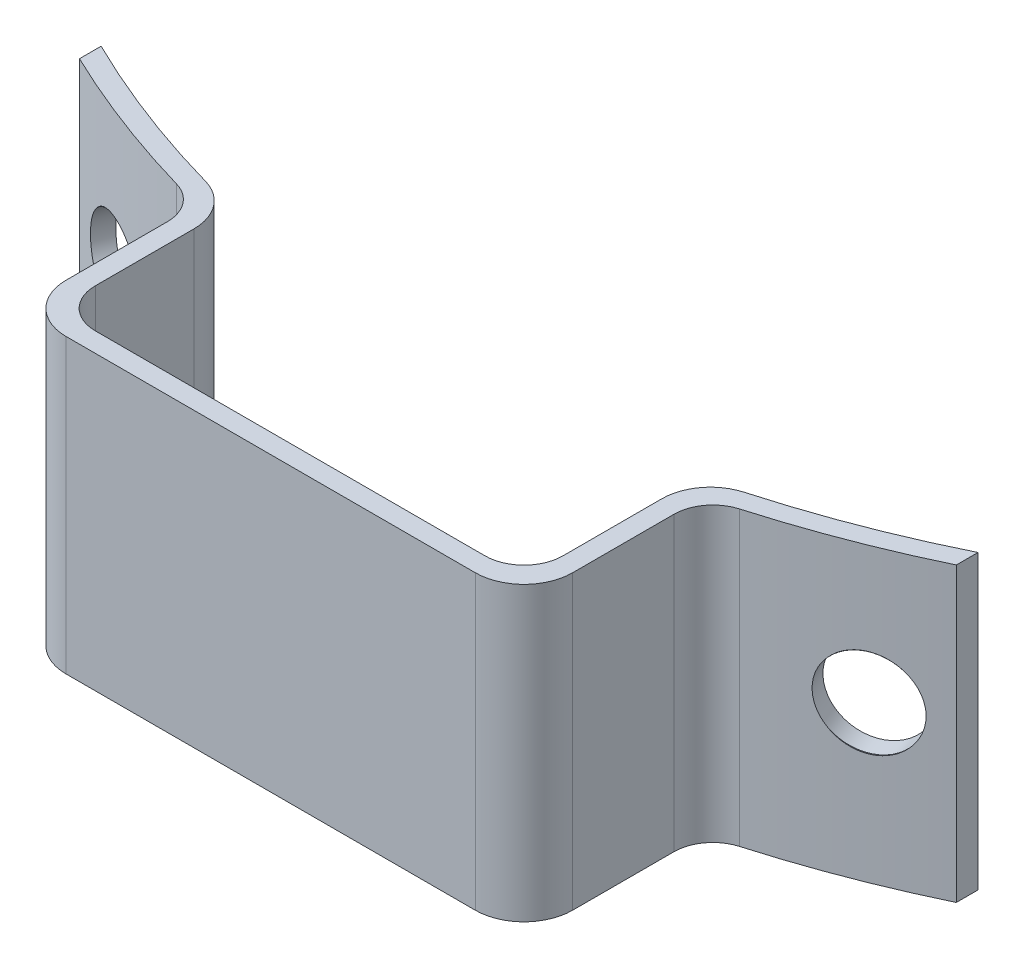
from build123d import *

# Parameters (mm, degrees)
EXTRUDE_1_DEPTH = 15
FILLET_1_R      = 2
FILLET_2_R      = 2.5


# Read off the part's stored shape, not the designer's step: Отверстие с зазором M41
with BuildPart() as part:
    # Эскиз1 → Бобышка-Вытянуть1 (new body)
    with BuildSketch(Plane(origin=(0, 0, 0), x_dir=(1, 0, 0), z_dir=(0, 1, 0))):
        with BuildLine():
            Line((-22.5, -46.880166382), (-22.5, -45.768438907))
            ThreePointArc((-22.5, -45.768438907), (-17.354305588, -47.956522784), (-12, -49.568134926))
            Line((-12, -49.568134926), (-12, -58.568134926))
            Line((-12, -58.568134926), (12, -58.568134926))
            Line((12, -58.568134926), (12, -49.568134926))
            ThreePointArc((12, -49.568134926), (17.354305588, -47.956522784), (22.5, -45.768438907))
            Line((22.5, -45.768438907), (22.5, -46.880166382))
            ThreePointArc((22.5, -46.880166382), (17.834526239, -48.845979096), (13, -50.348783501))
            Line((13, -50.348783501), (13, -59.568134926))
            Line((13, -59.568134926), (-13, -59.568134926))
            Line((-13, -59.568134926), (-13, -50.348783501))
            ThreePointArc((-13, -50.348783501), (-17.834526239, -48.845979096), (-22.5, -46.880166382))
        make_face()
    extrude(amount=EXTRUDE_1_DEPTH)

    # Скругление1
    fillet_1_edges = [part.edges().sort_by_distance(p)[0] for p in [
        (-13, 7.5, 50.348783501),
        (13, 7.5, 50.348783501),
        (12, 7.5, 58.568134926),
        (-12, 7.5, 58.568134926),
    ]]
    fillet(fillet_1_edges, radius=FILLET_1_R)

    # Скругление2
    fillet_2_edges = [part.edges().sort_by_distance(p)[0] for p in [
        (-12, 7.5, 49.568134926),
        (-13, 7.5, 59.568134926),
        (13, 7.5, 59.568134926),
        (12, 7.5, 49.568134926),
    ]]
    fillet(fillet_2_edges, radius=FILLET_2_R)

    # Отверстие с зазором M41 outline → Отверстие с зазором M41 (revolve, cut)
    with BuildSketch(Plane(origin=(0, 8, 0), x_dir=(0.9280125149960182, 0, -0.37254901960784303), z_dir=(0, -1, 0))):
        Polygon((2.25, 52.000021479), (2.25, 51.975), (2.275021479, 52.000021479), align=None)
        Polygon((2.25, 50.950316764), (2.25, 51.975), (2.25, 52.000021479), (0, 52.000021479), (0, 50.950316764), align=None)
    revolve(axis=Axis((0, 8, 0), (0.37254901960784303, 0, 0.9280125149960182)), mode=Mode.SUBTRACT)

    # Hole Wizard M41 2 outline → Hole Wizard M41 2 (revolve, cut)
    with BuildSketch(Plane(origin=(0, 8, 0), x_dir=(0.9280125149960182, 0, 0.37254901960784303), z_dir=(0, 1, 0))):
        Polygon((2.25, -52.000019282), (2.25, -51.975), (2.25, -50.950316764), (0, -50.950316764), (0, -52.000019282), align=None)
        Polygon((2.275019282, -52.000019282), (2.249998249, -51.974998249), (2.25, -52.000019282), align=None)
    revolve(axis=Axis((0, 8, 0), (0.37254901960784303, 0, -0.9280125149960182)), mode=Mode.SUBTRACT)


solid = part.part
